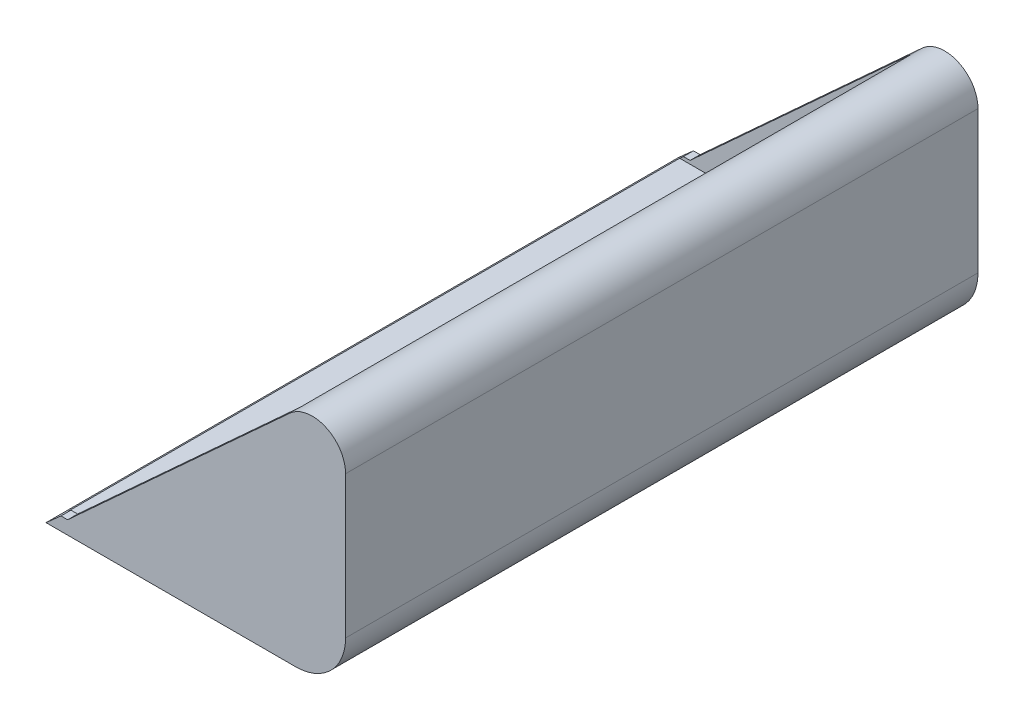
from build123d import *

# Parameters (mm, degrees)
BOSS_EXTRUDE1_DEPTH = 1900
SHELL1_START        = 30
SHELL1_DEPTH        = 1840
CUT_EXTRUDE1_DEPTH  = 2209.790719691


# Read off the part's stored shape, not the designer's step: Shell1
with BuildPart() as part:
    # Sketch2 → Boss-Extrude1 (new body)
    with BuildSketch(Plane.XY):
        with BuildLine():
            Line((0, 0), (750, 0))
            ThreePointArc((750, 0), (856.066017178, 43.933982822), (900, 150))
            Line((900, 150), (900, 577.315615791))
            ThreePointArc((900, 577.315615791), (840.965605157, 668.539621372), (733.563616117, 652.05654766))
            Line((733.563616117, 652.05654766), (0, 0))
        make_face()
    extrude(amount=BOSS_EXTRUDE1_DEPTH)

    # Shell1 outline → Shell1 (cut)
    with BuildSketch(Plane.XY.offset(SHELL1_START)):
        with BuildLine():
            Line((753.494531282, 629.634268099), (733.563616117, 652.05654766))
            Line((733.563616117, 652.05654766), (33.75, 30))
            Line((33.75, 30), (750, 30))
            ThreePointArc((750, 30), (834.852813742, 65.147186258), (870, 150))
            Line((870, 150), (870, 577.315615791))
            ThreePointArc((870, 577.315615791), (828.67592361, 641.172419698), (753.494531282, 629.634268099))
        make_face()
    extrude(amount=SHELL1_DEPTH, mode=Mode.SUBTRACT)

    # Sketch3 → Cut-Extrude1 (cut, through all)
    with BuildSketch(Plane.XY.offset(1900)):
        Polygon((45, 40), (65, 40), (733.563616117, 652.05654766), align=None)
    extrude(amount=-CUT_EXTRUDE1_DEPTH, mode=Mode.SUBTRACT)


solid = part.part
